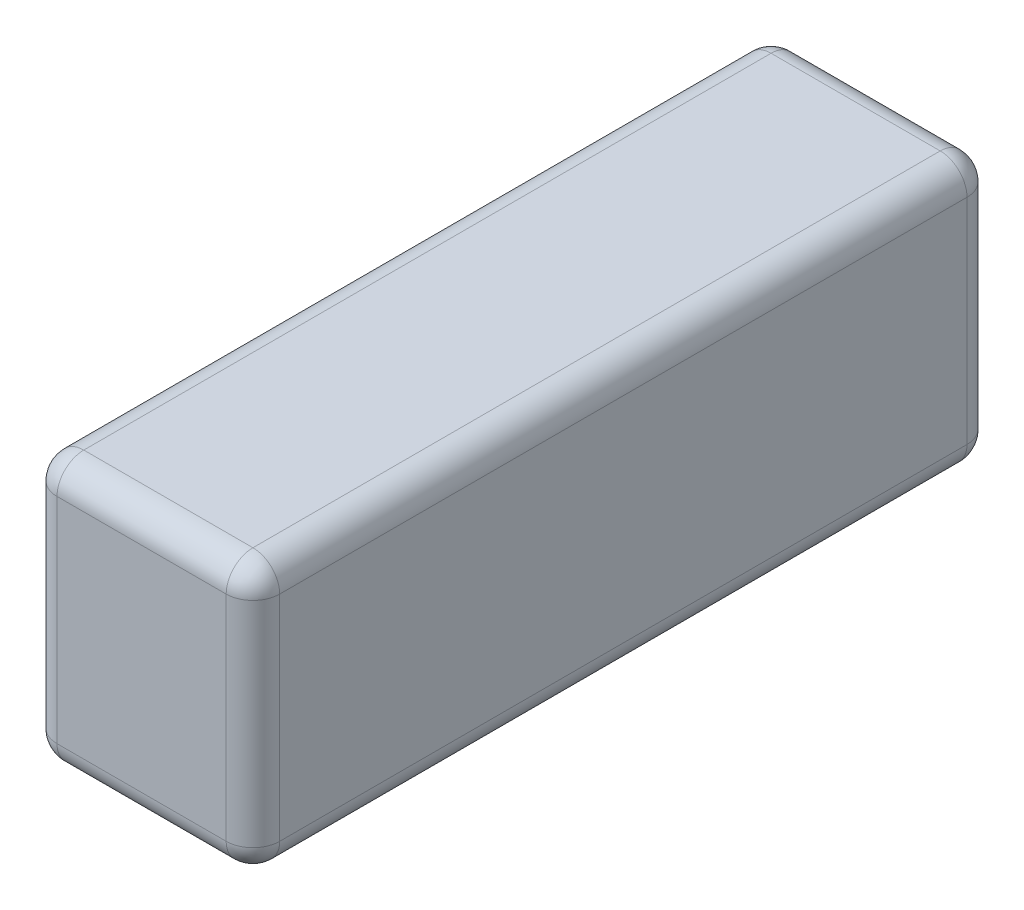
from build123d import *

# Parameters (mm, degrees)
SKETCH1_W           = 43.942
SKETCH1_H           = 15.875
BOSS_EXTRUDE1_DEPTH = 13.208
FILLET1_R           = 1.5875


with BuildPart() as part:
    # Sketch1 → Boss-Extrude1 (new body)
    with BuildSketch(Plane(origin=(0, 0, 0), x_dir=(0, 0, -1), z_dir=(1, 0, 0))):
        Rectangle(SKETCH1_W, SKETCH1_H)
    extrude(amount=BOSS_EXTRUDE1_DEPTH)

    # Fillet1
    fillet1_edges = [part.edges().sort_by_distance(p)[0] for p in [
        (0, 0, -21.971),
        (6.604, -7.9375, -21.971),
        (0, -7.9375, 0),
        (6.604, 7.9375, -21.971),
        (0, 7.9375, 0),
        (6.604, 7.9375, 21.971),
        (6.604, -7.9375, 21.971),
        (0, 0, 21.971),
        (13.208, 7.9375, 0),
        (13.208, 0, -21.971),
        (13.208, -7.9375, 0),
        (13.208, 0, 21.971),
    ]]
    fillet(fillet1_edges, radius=FILLET1_R)


solid = part.part
